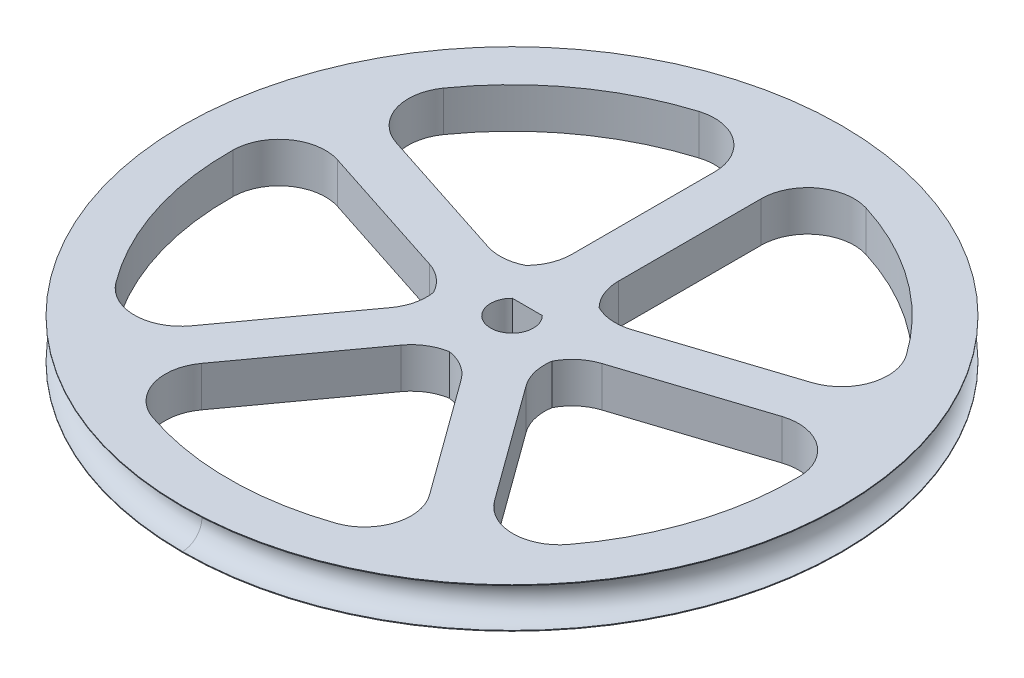
from build123d import *

# Parameters (mm, degrees)
SKETCH1_R           = 26.9875
BOSS_EXTRUDE1_DEPTH = 3.302
FILLET1_R           = 3.81
SKETCH2_R           = 1.5875


with BuildPart() as part:
    # Sketch1 → Boss-Extrude1 (new body)
    with BuildSketch(Plane(origin=(0, 0, 0), x_dir=(1, 0, 0), z_dir=(0, 1, 0))):
        with Locations(Location((0, 0, 0), (0, 0, 90))):
            Circle(SKETCH1_R)
        with BuildLine():
            Line((-1.905, 23.099079662), (-1.905, 4.709286039))
            ThreePointArc((-1.905, 4.709286039), (-2.985949082, 4.109806331), (-3.8901198, 3.267012081))
            Line((-3.8901198, 3.267012081), (-21.379852859, 8.949770834))
            ThreePointArc((-21.379852859, 8.949770834), (-13.623392685, 18.750991387), (-1.905, 23.099079662))
        make_face(mode=Mode.SUBTRACT)
        with BuildLine():
            Line((1.905, 23.099079662), (1.905, 4.709286039))
            ThreePointArc((1.905, 4.709286039), (2.985949082, 4.109806331), (3.8901198, 3.267012081))
            Line((3.8901198, 3.267012081), (21.379852859, 8.949770834))
            ThreePointArc((21.379852859, 8.949770834), (13.623392685, 18.750991387), (1.905, 23.099079662))
        make_face(mode=Mode.SUBTRACT)
        with BuildLine():
            Line((-22.557207608, 5.326245507), (-5.067474549, -0.356513246))
            ThreePointArc((-5.067474549, -0.356513246), (-4.831367103, -1.569806331), (-4.309226257, -2.690161532))
            Line((-4.309226257, -2.690161532), (-15.118475741, -17.567817096))
            ThreePointArc((-15.118475741, -17.567817096), (-22.043112406, -7.162241387), (-22.557207608, 5.326245507))
        make_face(mode=Mode.SUBTRACT)
        with BuildLine():
            Line((-1.226871508, -4.929623343), (-12.036120993, -19.807278907))
            ThreePointArc((-12.036120993, -19.807278907), (0, -23.1775), (12.036120993, -19.807278907))
            Line((12.036120993, -19.807278907), (1.226871508, -4.929623343))
            ThreePointArc((1.226871508, -4.929623343), (0, -5.08), (-1.226871508, -4.929623343))
        make_face(mode=Mode.SUBTRACT)
        with BuildLine():
            Line((22.557207608, 5.326245507), (5.067474549, -0.356513246))
            ThreePointArc((5.067474549, -0.356513246), (4.831367103, -1.569806331), (4.309226257, -2.690161532))
            Line((4.309226257, -2.690161532), (15.118475741, -17.567817096))
            ThreePointArc((15.118475741, -17.567817096), (22.043112406, -7.162241387), (22.557207608, 5.326245507))
        make_face(mode=Mode.SUBTRACT)
        with BuildLine():
            Line((-1.226374532, 1.253998), (1.226374532, 1.253998))
            ThreePointArc((1.226374532, 1.253998), (0, -1.753997), (-1.226374532, 1.253998))
        make_face(mode=Mode.SUBTRACT)
    extrude(amount=BOSS_EXTRUDE1_DEPTH)

    # Fillet1
    # the kernel refuses this fillet: 3.81 mm, written as the material it adds along each edge
    with BuildSketch(Plane(origin=(-22.557207608, 0, -5.326245507), x_dir=(0.9510565162951546, 0, 0.3090169943749439), z_dir=(0, 1, 0)), Plane(origin=(-1.905, 0, -23.099079662), x_dir=(0, 0, 1), z_dir=(0, 1, 0))) as fillet1_piece_1:
        with BuildLine():
            CenterArc((4.593976819, -3.81), FILLET1_R, 90, 107.162452548)
            ThreePointArc((0.953628718, -4.934262295), (0.342682242, -2.493054423), (0, 0))
            Line((0, 0), (4.593976819, 0))
        make_face()
    extrude(amount=3.302)
    with BuildSketch(Plane(origin=(-5.067474549, 0, 0.356513246), x_dir=(-0.9510565162951546, 0, -0.3090169943749442), z_dir=(0, 1, 0)), Plane(origin=(-1.226871508, 0, 4.929623343), x_dir=(-0.5877852522924791, 0, 0.8090169943749429), z_dir=(0, 1, 0)), Plane(origin=(4.309226257, 0, 2.690161532), x_dir=(0.5877852522924685, 0, 0.8090169943749509), z_dir=(0, 1, 0)), Plane(origin=(-1.905, 0, -4.709286039), x_dir=(0, 0, -1), z_dir=(0, 1, 0))) as fillet1_piece_2:
        with BuildLine():
            CenterArc((2.100330323, 3.81), FILLET1_R, 220.005200885, 49.994799115)
            ThreePointArc((-0.818076689, 1.360714286), (-0.355550163, 0.712514837), (0, 0))
            Line((0, 0), (2.100330323, 0))
        make_face()
    extrude(amount=3.302)
    with BuildSketch(Plane(origin=(-4.309226257, 0, 2.690161532), x_dir=(-0.3904940341583853, 0, -0.9206054579931132), z_dir=(0, 1, 0)), Plane(origin=(1.226871508, 0, 4.929623343), x_dir=(-0.9962171125182067, 0, 0.08689916412651309), z_dir=(0, 1, 0)), Plane(origin=(5.067474549, 0, 0.356513246), x_dir=(-0.22520200155214, 0, 0.9743120950172537), z_dir=(0, 1, 0)), Plane(origin=(1.905, 0, -4.709286039), x_dir=(0.8570346212244796, 0, 0.5152588262442601), z_dir=(0, 1, 0)), Plane(origin=(-3.8901198, 0, -3.267012081), x_dir=(0.7548785270042563, 0, -0.6558646273949256), z_dir=(0, 1, 0))) as fillet1_piece_3:
        with BuildLine():
            CenterArc((2.18308817, 3.763191931), FILLET1_R, 211.014756861, 49.994799115)
            Line((-1.082213737, 1.800055803), (0, 0))
            ThreePointArc((0, 0), (0.793850244, 0.062410759), (1.587700487, 0))
        make_face()
    extrude(amount=3.302)
    with BuildSketch(Plane(origin=(-15.118475741, 0, 17.567817096), x_dir=(0.5877852522924796, 0, -0.8090169943749426), z_dir=(0, 1, 0)), Plane(origin=(-21.379852859, 0, -8.949770834), x_dir=(0.9510565162951546, 0, 0.3090169943749444), z_dir=(0, 1, 0)), Plane(origin=(1.905, 0, -23.099079662), x_dir=(0, 0, 1), z_dir=(0, 1, 0))) as fillet1_piece_4:
        with BuildLine():
            CenterArc((4.593976819, 3.81), FILLET1_R, 162.837547452, 107.162452548)
            ThreePointArc((0.953628718, 4.934262295), (0.342682242, 2.493054423), (0, 0))
            Line((0, 0), (4.593976819, 0))
        make_face()
    extrude(amount=3.302)
    with BuildSketch(Plane(origin=(12.036120993, 0, 19.807278907), x_dir=(-0.9058536844822791, 0, 0.42359072500454903), z_dir=(0, 1, 0)), Plane(origin=(22.557207608, 0, -5.326245507), x_dir=(0.1229345363355818, 0, 0.9924147821228559), z_dir=(0, 1, 0))) as fillet1_piece_5:
        with BuildLine():
            CenterArc((4.612509297, -3.78754287), FILLET1_R, 83.776053996, 107.162452548)
            Line((0.871731639, -4.510510721), (0, 0))
            ThreePointArc((0, 0), (2.512784916, 0.136614205), (5.025569831, 0))
        make_face()
    extrude(amount=3.302)
    with BuildSketch(Plane(origin=(-12.036120993, 0, 19.807278907), x_dir=(0.9058536844822742, 0, 0.42359072500455974), z_dir=(0, 1, 0)), Plane(origin=(15.118475741, 0, 17.567817096), x_dir=(0.6827829021799576, 0, -0.7306213167508284), z_dir=(0, 1, 0)), Plane(origin=(21.379852859, 0, -8.949770834), x_dir=(-0.4838706439977688, 0, -0.8751395316617714), z_dir=(0, 1, 0))) as fillet1_piece_6:
        with BuildLine():
            CenterArc((4.612509297, 3.78754287), FILLET1_R, 169.061493455, 107.162452548)
            Line((0.871731639, 4.510510721), (0, 0))
            ThreePointArc((0, 0), (2.512784916, -0.136614205), (5.025569831, 0))
        make_face()
    extrude(amount=3.302)
    with BuildSketch(Plane(origin=(3.8901198, 0, -3.267012081), x_dir=(-0.7548785270042564, 0, -0.6558646273949251), z_dir=(0, 1, 0))) as fillet1_piece_7:
        with BuildLine():
            CenterArc((2.18308817, -3.763191931), FILLET1_R, 98.990444024, 49.994799115)
            Line((-1.082213737, -1.800055803), (0, 0))
            ThreePointArc((0, 0), (0.793850244, -0.062410759), (1.587700487, 0))
        make_face()
    extrude(amount=3.302)

    # Cut-Sweep1: sweep along a curve in space
    with BuildLine() as cut_sweep1_path:
        ThreePointArc((0, 0, 26.9875), (19.083044257, 0, 19.083044257), (26.9875, 0, 0))
        ThreePointArc((26.9875, 0, 0), (19.083044257, 0, -19.083044257), (0, 0, -26.9875))
        ThreePointArc((0, 0, -26.9875), (-19.083044257, 0, -19.083044257), (-26.9875, 0, 0))
        ThreePointArc((-26.9875, 0, 0), (-19.083044257, 0, 19.083044257), (0, 0, 26.9875))
    # Sketch2 → Cut-Sweep1 (sweep, cut)
    with BuildSketch(Plane(origin=(0, 0, 0), x_dir=(0, 0, -1), z_dir=(1, 0, 0))):
        with Locations((26.9875, 1.651)):
            Circle(SKETCH2_R)
    sweep(path=cut_sweep1_path.line, mode=Mode.SUBTRACT)


solid = part.part
